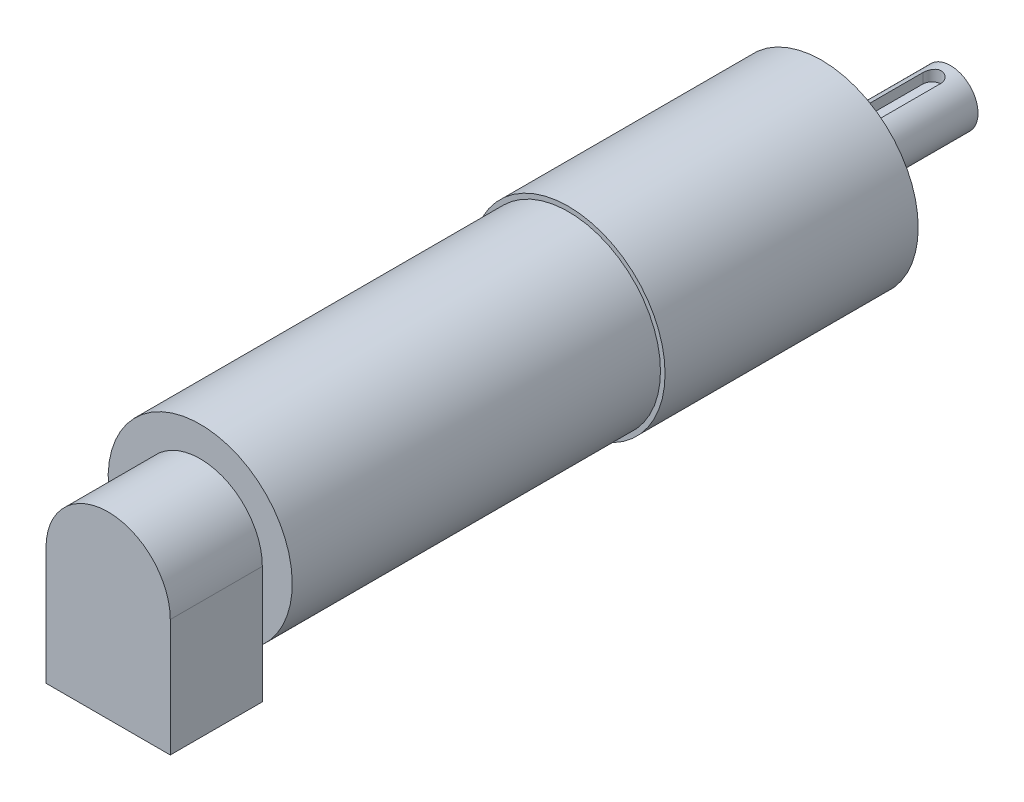
from build123d import *

# Parameters (mm, degrees)
SKETCH_1_R                  = 21
EXTRUDE_406_DEPTH           = 55
SKETCH_2_R                  = 20
EXTRUDE_503_DEPTH           = 80
EXTRUDE_726_DEPTH           = 20
SKETCH_5_R                  = 14
EXTRUDE_845_DEPTH           = 3
SKETCH_4_R                  = 6
EXTRUDE_966_DEPTH           = 25
CUT_EXTRUDE_1_DEPTH         = 2.5
HOLE_WIZARD_M4_1_AT_2_COUNT = 2
HOLE_WIZARD_M4_1_AT_2_PITCH = 24.748737342
HOLE_WIZARD_M4_1_AT_3_COUNT = 2
HOLE_WIZARD_M4_1_AT_3_PITCH = 35
HOLE_WIZARD_M4_1_AT_4_COUNT = 2
HOLE_WIZARD_M4_1_AT_4_PITCH = 24.748737342


with BuildPart() as part:
    # 草图1 → Extrude 406 (new body)
    with BuildSketch(Plane.XY):
        Circle(SKETCH_1_R)
    extrude(amount=EXTRUDE_406_DEPTH)

    # 草图2 → Extrude 503 (add)
    with BuildSketch(Plane.XY.offset(55)):
        Circle(SKETCH_2_R)
    extrude(amount=EXTRUDE_503_DEPTH)

    # 草图3 → Extrude 726 (add)
    with BuildSketch(Plane.XY.offset(135)):
        with BuildLine():
            Line((-13.5, -25.5), (13.5, -25.5))
            Line((13.5, -25.5), (13.5, 0))
            ThreePointArc((13.5, 0), (0, 13.5), (-13.5, 0))
            Line((-13.5, 0), (-13.5, -25.5))
        make_face()
    extrude(amount=EXTRUDE_726_DEPTH)

    # 草图5 → Extrude 845 (add)
    with BuildSketch(Plane(origin=(0, 0, 0), x_dir=(-1, 0, 0), z_dir=(0, 0, -1))):
        Circle(SKETCH_5_R)
    extrude(amount=EXTRUDE_845_DEPTH)

    # 草图7 → M4 螺纹孔1 (revolve, cut)
    with BuildSketch(Plane(origin=(0, 17.5, 0), x_dir=(0, 1, 0), z_dir=(1, 0, 0))):
        Polygon((0, 0), (0, 6.991420021), (1.65, 6), (1.65, 0), align=None)
    hole_wizard_m4_1 = revolve(axis=Axis((0, 17.5, -6.35), (0, 0, 1)), mode=Mode.SUBTRACT)

    # M4 螺纹孔1 at 2: M4 螺纹孔1 ×2
    with Locations(*[Vector(-0.7071067811865575, -0.7071067811865376, 0) * (i * HOLE_WIZARD_M4_1_AT_2_PITCH) for i in range(1, HOLE_WIZARD_M4_1_AT_2_COUNT)]):
        add(hole_wizard_m4_1, mode=Mode.SUBTRACT)

    # M4 螺纹孔1 at 3: M4 螺纹孔1 ×2
    with Locations(*[(0, -i * HOLE_WIZARD_M4_1_AT_3_PITCH, 0) for i in range(1, HOLE_WIZARD_M4_1_AT_3_COUNT)]):
        add(hole_wizard_m4_1, mode=Mode.SUBTRACT)

    # M4 螺纹孔1 at 4: M4 螺纹孔1 ×2
    with Locations(*[Vector(0.7071067811865376, -0.7071067811865576, 0) * (i * HOLE_WIZARD_M4_1_AT_4_PITCH) for i in range(1, HOLE_WIZARD_M4_1_AT_4_COUNT)]):
        add(hole_wizard_m4_1, mode=Mode.SUBTRACT)


with BuildPart() as body_2:
    # 草图4 → Extrude 966 (new body)
    with BuildSketch(Plane(origin=(0, 0, -3), x_dir=(-1, 0, 0), z_dir=(0, 0, -1))):
        Circle(SKETCH_4_R)
    extrude(amount=EXTRUDE_966_DEPTH)

    # 草图6 → 切除-拉伸1 (cut)
    with BuildSketch(Plane(origin=(0, 6, 0), x_dir=(-1, 0, 0), z_dir=(0, 1, 0))):
        with BuildLine():
            Line((-2, -24), (-2, -8))
            ThreePointArc((-2, -8), (0, -6), (2, -8))
            Line((2, -8), (2, -24))
            ThreePointArc((2, -24), (0, -26), (-2, -24))
        make_face()
    extrude(amount=-CUT_EXTRUDE_1_DEPTH, mode=Mode.SUBTRACT)


solid = Compound([part.part, body_2.part])
